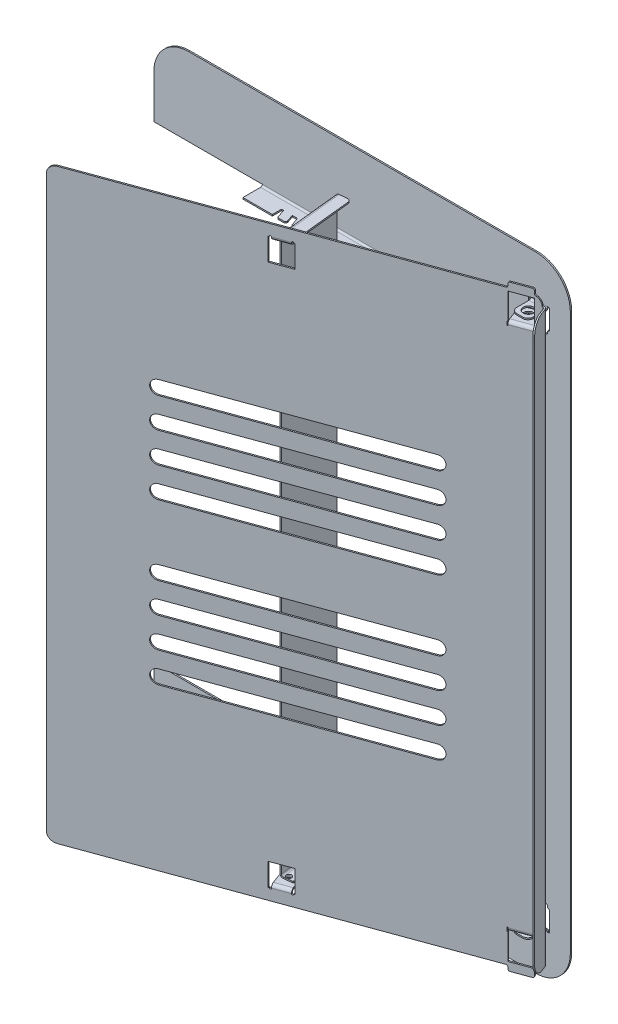
from build123d import *

# Parameters (mm, degrees)
BODY1_DEPTH                    = 0.8
BODY2_DEPTH                    = 115
BODY2_BEND_DEPTH               = 115
CUT_EXTRUDE1_DEPTH             = 10
EDGE_FLANGE5_DEPTH             = 9.5
EDGE_FLANGE5_BEND_DEPTH        = 9.5
FILLET2_R                      = 3
SKETCH25_W                     = 15
SKETCH25_H                     = 12
BODY3_DEPTH                    = 0.8
BODY4_START                    = 95.6
BODY4_DEPTH                    = 12.8
BODY4_2_DEPTH                  = 0.4
BODY4_START_2                  = 108
BODY4_3_DEPTH                  = 0.4
BODY4_START_3                  = 96
BODY4_4_DEPTH                  = 12
FILLET3_R                      = 3
SKETCH34_R                     = 3
CUT_EXTRUDE2_DEPTH             = 454
CUT_EXTRUDE3_DEPTH             = 454
EDGE_FLANGE7_DEPTH             = 9
EDGE_FLANGE7_BEND_DEPTH        = 9
FILLET4_R                      = 3
SKETCH42_W                     = 42
SKETCH42_H                     = 321.4
BASE_FLANGE3_DEPTH             = 0.8
SKETCH45_W                     = 43.953673058
SKETCH45_H                     = 5.967432984
CUT_EXTRUDE4_DEPTH             = 279.8
EDGE_FLANGE8_STRIP_W           = 5.2
EDGE_FLANGE8_STRIP_H           = 0.8
EDGE_FLANGE8_STRIP_CUT_DEPTH   = 42
EDGE_FLANGE8_STRIP_2_W         = 5.2
EDGE_FLANGE8_STRIP_2_H         = 0.8
EDGE_FLANGE8_STRIP_CUT_2_DEPTH = 42
EDGE_FLANGE8_DEPTH             = 42
EDGE_FLANGE8_BEND_DEPTH        = 42
FILLET5_START                  = -160.7
FILLET5_DEPTH                  = 321.4
FILLET6_R                      = 2
SKETCH52_R                     = 1.5
CUT_EXTRUDE5_DEPTH             = 334.8
BODY_MOVE_COPY4_ANGLE          = 20
BODY_MOVE_COPY6_ANGLE          = 77
CUT_EXTRUDE7_DEPTH             = 334.8
BASE_FLANGE4_DEPTH             = 0.8
LPATTERN1_COUNT                = 2
LPATTERN1_PITCH                = 10
LPATTERN2_COUNT                = 3
LPATTERN2_PITCH                = 8
BODY_MOVE_COPY8_ANGLE          = 7
CUT_EXTRUDE8_DEPTH             = 334.8
FILLET7_R                      = 0.5
FILLET8_R                      = 0.5
EDGE_FLANGE9_DEPTH             = 328
FILLET9_R                      = 7
CUT_EXTRUDE9_DEPTH             = 334.8
SKETCH83_W                     = 62.5
SKETCH83_H                     = 270
CUT_EXTRUDE11_DEPTH            = 10


with BuildPart() as part:
    # body1: sheet metal written as solids
    # Sketch1 → body1 (new body)
    with BuildSketch(Plane(origin=(0, 0, 0), x_dir=(0, 1, 0), z_dir=(0, 0, 1))):
        with BuildLine():
            Line((160, -120), (-160, -120))
            ThreePointArc((-160, -120), (-174.142135624, -114.142135624), (-180, -100))
            Line((-180, -100), (-180, 100))
            ThreePointArc((-180, 100), (-174.142135624, 114.142135624), (-160, 120))
            Line((-160, 120), (160, 120))
            ThreePointArc((160, 120), (174.142135624, 114.142135624), (180, 100))
            Line((180, 100), (180, -100))
            ThreePointArc((180, -100), (174.142135624, -114.142135624), (160, -120))
        make_face()
        with BuildLine():
            Line((115, -77.5), (-115, -77.5))
            ThreePointArc((-115, -77.5), (-129.142135624, -71.642135624), (-135, -57.5))
            Line((-135, -57.5), (-135, 57.5))
            ThreePointArc((-135, 57.5), (-129.142135624, 71.642135624), (-115, 77.5))
            Line((-115, 77.5), (115, 77.5))
            ThreePointArc((115, 77.5), (129.142135624, 71.642135624), (135, 57.5))
            Line((135, 57.5), (135, -57.5))
            ThreePointArc((135, -57.5), (129.142135624, -71.642135624), (115, -77.5))
        make_face(mode=Mode.SUBTRACT)
    extrude(amount=-BODY1_DEPTH)

    # body2: sheet metal written as solids
    # body2 section (on a plane across the edge) → body2 (add)
    with BuildSketch(Plane(origin=(57.5, -134, 0), x_dir=(0, -1, 0), z_dir=(-1, 0, 0))):
        with BuildLine():
            Line((-0.8, 1), (-0.8, 11.2))
            Line((-0.8, 11.2), (0, 11.2))
            Line((0, 11.2), (0, 1))
            ThreePointArc((0, 1), (0.292893219, 0.292893219), (1, 0))
            Line((1, 0), (1, -0.8))
            ThreePointArc((1, -0.8), (-0.272792206, -0.272792206), (-0.8, 1))
        make_face()
    extrude(amount=BODY2_DEPTH)

    # body2 section 2 (on a plane across the edge) → body2 bend (add)
    with BuildSketch(Plane(origin=(-57.5, 134, 0), x_dir=(0, 1, 0), z_dir=(1, 0, 0))):
        with BuildLine():
            Line((-0.8, 1), (-0.8, 11.2))
            Line((-0.8, 11.2), (0, 11.2))
            Line((0, 11.2), (0, 1))
            ThreePointArc((0, 1), (0.292893219, 0.292893219), (1, 0))
            Line((1, 0), (1, -0.8))
            ThreePointArc((1, -0.8), (-0.272792206, -0.272792206), (-0.8, 1))
        make_face()
    extrude(amount=BODY2_BEND_DEPTH)

    # Sketch18 → Cut-Extrude1 (cut)
    with BuildSketch(Plane.XY):
        with BuildLine():
            Line((107, 144), (106.85, 144))
            Line((106.85, 144), (106.85, 143))
            ThreePointArc((106.85, 143), (106.557106781, 142.292893219), (105.85, 142))
            Line((105.85, 142), (98.15, 142))
            ThreePointArc((98.15, 142), (97.442893219, 142.292893219), (97.15, 143))
            Line((97.15, 143), (97.15, 144))
            Line((97.15, 144), (97, 144))
            ThreePointArc((97, 144), (96.292893219, 144.292893219), (96, 145))
            Line((96, 145), (96, 156))
            Line((96, 156), (96.75, 156))
            ThreePointArc((96.75, 156), (97, 156.25), (97.25, 156))
            Line((97.25, 156), (106.75, 156))
            ThreePointArc((106.75, 156), (107, 156.25), (107.25, 156))
            Line((107.25, 156), (108, 156))
            Line((108, 156), (108, 145))
            ThreePointArc((108, 145), (107.707106781, 144.292893219), (107, 144))
        make_face()
        with BuildLine():
            Line((108, -156), (107.25, -156))
            ThreePointArc((107.25, -156), (107, -156.25), (106.75, -156))
            Line((106.75, -156), (97.25, -156))
            ThreePointArc((97.25, -156), (97, -156.25), (96.75, -156))
            Line((96.75, -156), (96, -156))
            Line((96, -156), (96, -145))
            ThreePointArc((96, -145), (96.292893219, -144.292893219), (97, -144))
            Line((97, -144), (97.15, -144))
            Line((97.15, -144), (97.15, -143))
            ThreePointArc((97.15, -143), (97.442893219, -142.292893219), (98.15, -142))
            Line((98.15, -142), (105.85, -142))
            ThreePointArc((105.85, -142), (106.557106781, -142.292893219), (106.85, -143))
            Line((106.85, -143), (106.85, -144))
            Line((106.85, -144), (107, -144))
            ThreePointArc((107, -144), (107.707106781, -144.292893219), (108, -145))
            Line((108, -145), (108, -156))
        make_face()
    extrude(amount=-CUT_EXTRUDE1_DEPTH, mode=Mode.SUBTRACT)

    # Edge-Flange5: sheet metal written as solids
    # Edge-Flange5 section (on a plane across the edge) → Edge-Flange5 (add)
    with BuildSketch(Plane(origin=(106.75, -155, 0), x_dir=(0, -1, 0), z_dir=(-1, 0, 0))):
        with BuildLine():
            Line((-0.8, 1), (-0.8, 11.2))
            Line((-0.8, 11.2), (0, 11.2))
            Line((0, 11.2), (0, 1))
            ThreePointArc((0, 1), (0.292893219, 0.292893219), (1, 0))
            Line((1, 0), (1, -0.8))
            ThreePointArc((1, -0.8), (-0.272792206, -0.272792206), (-0.8, 1))
        make_face()
    extrude(amount=EDGE_FLANGE5_DEPTH)

    # Edge-Flange5 section 2 (on a plane across the edge) → Edge-Flange5 bend (add)
    with BuildSketch(Plane(origin=(97.25, 155, 0), x_dir=(0, 1, 0), z_dir=(1, 0, 0))):
        with BuildLine():
            Line((-0.8, 1), (-0.8, 11.2))
            Line((-0.8, 11.2), (0, 11.2))
            Line((0, 11.2), (0, 1))
            ThreePointArc((0, 1), (0.292893219, 0.292893219), (1, 0))
            Line((1, 0), (1, -0.8))
            ThreePointArc((1, -0.8), (-0.272792206, -0.272792206), (-0.8, 1))
        make_face()
    extrude(amount=EDGE_FLANGE5_BEND_DEPTH)

    # Fillet2
    fillet2_edges = [part.edges().sort_by_distance(p)[0] for p in [
        (106.75, -154.6, 11.2),
        (97.25, -154.6, 11.2),
        (97.25, 154.6, 11.2),
        (106.75, 154.6, 11.2),
    ]]
    fillet(fillet2_edges, radius=FILLET2_R)


with BuildPart() as body_2:
    # body3: sheet metal written as solids
    # Sketch25 → body3 (new body)
    with BuildSketch(Plane(origin=(0, 0, 13.2), x_dir=(0, 1, 0), z_dir=(0, 0, 1))):
        with BuildLine():
            Line((164, 111.5), (-164, 111.5))
            ThreePointArc((-164, 111.5), (-167.535533906, 110.035533906), (-169, 106.5))
            Line((-169, 106.5), (-169, -95))
            ThreePointArc((-169, -95), (-169.292893219, -95.707106781), (-170, -96))
            Line((-170, -96), (-171, -96))
            ThreePointArc((-171, -96), (-171.707106781, -96.292893219), (-172, -97))
            Line((-172, -97), (-172, -107))
            ThreePointArc((-172, -107), (-171.707106781, -107.707106781), (-171, -108))
            Line((-171, -108), (-169.454356057, -108))
            ThreePointArc((-169.454356057, -108), (-168.914294332, -108.158374588), (-168.545296714, -108.583333333))
            ThreePointArc((-168.545296714, -108.583333333), (-166.700308624, -110.708127058), (-164, -111.5))
            Line((-164, -111.5), (164, -111.5))
            ThreePointArc((164, -111.5), (166.700308624, -110.708127058), (168.545296714, -108.583333333))
            ThreePointArc((168.545296714, -108.583333333), (168.914294332, -108.158374588), (169.454356057, -108))
            Line((169.454356057, -108), (171, -108))
            ThreePointArc((171, -108), (171.707106781, -107.707106781), (172, -107))
            Line((172, -107), (172, -97))
            ThreePointArc((172, -97), (171.707106781, -96.292893219), (171, -96))
            Line((171, -96), (170, -96))
            ThreePointArc((170, -96), (169.292893219, -95.707106781), (169, -95))
            Line((169, -95), (169, 106.5))
            ThreePointArc((169, 106.5), (167.535533906, 110.035533906), (164, 111.5))
        make_face()
        with Locations((159.8, -102)):
            Rectangle(SKETCH25_W, SKETCH25_H, mode=Mode.SUBTRACT)
        with Locations((-159.8, -102)):
            Rectangle(SKETCH25_W, SKETCH25_H, mode=Mode.SUBTRACT)
    extrude(amount=-BODY3_DEPTH)

    # body4: read off the stored shape, not the designer's step
    # body4 outline → body4 (cut)
    with BuildSketch(Plane.YZ.offset(BODY4_START)):
        with BuildLine():
            ThreePointArc((-151.996662954, 12.4), (-151.348528137, 12.987450787), (-150.5, 13.2))
            Line((-150.5, 13.2), (-152.3, 13.2))
            Line((-152.3, 13.2), (-152.3, 12.4))
            Line((-152.3, 12.4), (-151.996662954, 12.4))
        make_face()
        with BuildLine():
            Line((152.3, 13.2), (150.5, 13.2))
            ThreePointArc((150.5, 13.2), (151.348528137, 12.987450787), (151.996662954, 12.4))
            Line((151.996662954, 12.4), (152.3, 12.4))
            Line((152.3, 12.4), (152.3, 13.2))
        make_face()
    extrude(amount=BODY4_DEPTH, mode=Mode.SUBTRACT)

    # body4 2 outline → body4 2 (cut)
    with BuildSketch(Plane.YZ.offset(BODY4_START)):
        with BuildLine():
            Line((-150.1, 12.4), (-150.1, 13.2))
            Line((-150.1, 13.2), (-150.5, 13.2))
            ThreePointArc((-150.5, 13.2), (-151.348528137, 12.987450787), (-151.996662954, 12.4))
            Line((-151.996662954, 12.4), (-150.1, 12.4))
        make_face()
        with BuildLine():
            Line((150.5, 13.2), (150.1, 13.2))
            Line((150.1, 13.2), (150.1, 12.4))
            Line((150.1, 12.4), (151.996662954, 12.4))
            ThreePointArc((151.996662954, 12.4), (151.348528137, 12.987450787), (150.5, 13.2))
        make_face()
    extrude(amount=BODY4_2_DEPTH, mode=Mode.SUBTRACT)

    # body4 3 outline → body4 3 (cut)
    with BuildSketch(Plane.YZ.offset(BODY4_START_2)):
        with BuildLine():
            Line((-150.1, 12.4), (-150.1, 13.2))
            Line((-150.1, 13.2), (-150.5, 13.2))
            ThreePointArc((-150.5, 13.2), (-151.348528137, 12.987450787), (-151.996662954, 12.4))
            Line((-151.996662954, 12.4), (-150.1, 12.4))
        make_face()
        with BuildLine():
            Line((150.5, 13.2), (150.1, 13.2))
            Line((150.1, 13.2), (150.1, 12.4))
            Line((150.1, 12.4), (151.996662954, 12.4))
            ThreePointArc((151.996662954, 12.4), (151.348528137, 12.987450787), (150.5, 13.2))
        make_face()
    extrude(amount=BODY4_3_DEPTH, mode=Mode.SUBTRACT)

    # body4 4 outline → body4 4 (add)
    with BuildSketch(Plane.YZ.offset(BODY4_START_3)):
        with BuildLine():
            ThreePointArc((-151.5, 11.4), (-151.207106781, 12.107106781), (-150.5, 12.4))
            Line((-150.5, 12.4), (-151.996662954, 12.4))
            ThreePointArc((-151.996662954, 12.4), (-152.222497216, 11.922497216), (-152.3, 11.4))
            Line((-152.3, 11.4), (-152.3, 1.2))
            Line((-152.3, 1.2), (-151.5, 1.2))
            Line((-151.5, 1.2), (-151.5, 11.4))
        make_face()
        with BuildLine():
            Line((151.996662954, 12.4), (150.5, 12.4))
            ThreePointArc((150.5, 12.4), (151.207106781, 12.107106781), (151.5, 11.4))
            Line((151.5, 11.4), (151.5, 1.2))
            Line((151.5, 1.2), (152.3, 1.2))
            Line((152.3, 1.2), (152.3, 11.4))
            ThreePointArc((152.3, 11.4), (152.222497216, 11.922497216), (151.996662954, 12.4))
        make_face()
    extrude(amount=BODY4_4_DEPTH)

    # Fillet3
    fillet3_edges = [body_2.edges().sort_by_distance(p)[0] for p in [
        (108, -151.9, 1.2),
        (96, -151.9, 1.2),
        (96, 151.9, 1.2),
        (108, 151.9, 1.2),
    ]]
    fillet(fillet3_edges, radius=FILLET3_R)


with BuildPart() as cut_extrude2_tool:
    # Sketch34 → Cut-Extrude2 (new body)
    with BuildSketch(Plane.XZ.offset(155)):
        with Locations(Location((102, 6.1, 0), (0, 0, 270))):
            Circle(SKETCH34_R)
    extrude(amount=-CUT_EXTRUDE2_DEPTH)


with BuildPart() as part_1:
    add(part.part)

    # Cut-Extrude2: cut by cut_extrude2_tool
    add(cut_extrude2_tool.part, mode=Mode.SUBTRACT)

    # Sketch45 → Cut-Extrude4 (cut)
    with BuildSketch(Plane(origin=(0, 134, 0), x_dir=(-1, 0, 0), z_dir=(0, 1, 0))):
        with Locations((18.557086861, 8.88567689)):
            Rectangle(SKETCH45_W, SKETCH45_H)
    extrude(amount=-CUT_EXTRUDE4_DEPTH, mode=Mode.SUBTRACT)


with BuildPart() as body_2_1:
    add(body_2.part)

    # Cut-Extrude2: cut by cut_extrude2_tool
    add(cut_extrude2_tool.part, mode=Mode.SUBTRACT)

    # Sketch35 → Cut-Extrude3 (cut)
    with BuildSketch(Plane.XY.offset(13.2)):
        with BuildLine():
            Line((0.25, 149.5), (-11.75, 149.5))
            Line((-11.75, 149.5), (-11.75, 162.5))
            Line((-11.75, 162.5), (-11.25, 162.5))
            ThreePointArc((-11.25, 162.5), (-10.75, 163), (-10.25, 162.5))
            Line((-10.25, 162.5), (-1.25, 162.5))
            ThreePointArc((-1.25, 162.5), (-0.75, 163), (-0.25, 162.5))
            Line((-0.25, 162.5), (0.25, 162.5))
            Line((0.25, 162.5), (0.25, 149.5))
        make_face()
        with BuildLine():
            Line((0.25, -149.5), (-11.75, -149.5))
            Line((-11.75, -149.5), (-11.75, -162.5))
            Line((-11.75, -162.5), (-11.25, -162.5))
            ThreePointArc((-11.25, -162.5), (-10.75, -163), (-10.25, -162.5))
            Line((-10.25, -162.5), (-1.25, -162.5))
            ThreePointArc((-1.25, -162.5), (-0.75, -163), (-0.25, -162.5))
            Line((-0.25, -162.5), (0.25, -162.5))
            Line((0.25, -162.5), (0.25, -149.5))
        make_face()
    extrude(amount=-CUT_EXTRUDE3_DEPTH, mode=Mode.SUBTRACT)

    # Edge-Flange7: sheet metal written as solids
    # Edge-Flange7 section (on a plane across the edge) → Edge-Flange7 (add)
    with BuildSketch(Plane(origin=(-10.25, -161.5, 12.4), x_dir=(0, -1, 0), z_dir=(1, 0, 0))):
        with BuildLine():
            Line((-0.8, 1), (-0.8, 9.2))
            Line((-0.8, 9.2), (0, 9.2))
            Line((0, 9.2), (0, 1))
            ThreePointArc((0, 1), (0.292893219, 0.292893219), (1, 0))
            Line((1, 0), (1, -0.8))
            ThreePointArc((1, -0.8), (-0.272792206, -0.272792206), (-0.8, 1))
        make_face()
    extrude(amount=EDGE_FLANGE7_DEPTH)

    # Edge-Flange7 section 2 (on a plane across the edge) → Edge-Flange7 bend (add)
    with BuildSketch(Plane(origin=(-1.25, 161.5, 12.4), x_dir=(0, 1, 0), z_dir=(-1, 0, 0))):
        with BuildLine():
            Line((-0.8, 1), (-0.8, 9.2))
            Line((-0.8, 9.2), (0, 9.2))
            Line((0, 9.2), (0, 1))
            ThreePointArc((0, 1), (0.292893219, 0.292893219), (1, 0))
            Line((1, 0), (1, -0.8))
            ThreePointArc((1, -0.8), (-0.272792206, -0.272792206), (-0.8, 1))
        make_face()
    extrude(amount=EDGE_FLANGE7_BEND_DEPTH)

    # Fillet4
    fillet4_edges = [body_2_1.edges().sort_by_distance(p)[0] for p in [
        (-10.25, -161.1, 3.2),
        (-1.25, -161.1, 3.2),
        (-1.25, 161.1, 3.2),
        (-10.25, 161.1, 3.2),
    ]]
    fillet(fillet4_edges, radius=FILLET4_R)


with BuildPart() as body_3:
    # Base-Flange3: sheet metal written as solids
    # Sketch42 → Base-Flange3 (new body)
    with BuildSketch(Plane(origin=(0, 0, 12.4), x_dir=(1, 0, 0), z_dir=(0, 0, -1))):
        with Locations((-19.25, 0)):
            Rectangle(SKETCH42_W, SKETCH42_H)
    extrude(amount=BASE_FLANGE3_DEPTH)


with BuildPart() as body_3_1:
    # Body-Move/Copy1: moved
    add(body_3.part.moved(Location((0, 0, -3))))

    # Edge-Flange8: sheet metal written as solids
    # Edge-Flange8 strip (on a plane across the edge) → Edge-Flange8 strip cut (cut)
    with BuildSketch(Plane(origin=(-40.25, 160.7, 8.6), x_dir=(0, -1, 0), z_dir=(1, 0, 0))):
        with Locations((-0.8, -0.4)):
            Rectangle(EDGE_FLANGE8_STRIP_W, EDGE_FLANGE8_STRIP_H)
    extrude(amount=EDGE_FLANGE8_STRIP_CUT_DEPTH, mode=Mode.SUBTRACT)

    # Edge-Flange8 strip 2 (on a plane across the edge) → Edge-Flange8 strip cut 2 (cut)
    with BuildSketch(Plane(origin=(1.75, -160.7, 8.6), x_dir=(0, 1, 0), z_dir=(-1, 0, 0))):
        with Locations((-0.8, -0.4)):
            Rectangle(EDGE_FLANGE8_STRIP_2_W, EDGE_FLANGE8_STRIP_2_H)
    extrude(amount=EDGE_FLANGE8_STRIP_CUT_2_DEPTH, mode=Mode.SUBTRACT)

    # Edge-Flange8 section (on a plane across the edge) → Edge-Flange8 (add)
    with BuildSketch(Plane(origin=(-40.25, 160.7, 8.6), x_dir=(0, -1, 0), z_dir=(1, 0, 0))):
        with BuildLine():
            Line((0, 1), (0, 7.2))
            Line((0, 7.2), (0.8, 7.2))
            Line((0.8, 7.2), (0.8, 1))
            ThreePointArc((0.8, 1), (1.092893219, 0.292893219), (1.8, 0))
            Line((1.8, 0), (1.8, -0.8))
            ThreePointArc((1.8, -0.8), (0.527207794, -0.272792206), (0, 1))
        make_face()
    extrude(amount=EDGE_FLANGE8_DEPTH)

    # Edge-Flange8 section 2 (on a plane across the edge) → Edge-Flange8 bend (add)
    with BuildSketch(Plane(origin=(1.75, -160.7, 8.6), x_dir=(0, 1, 0), z_dir=(-1, 0, 0))):
        with BuildLine():
            Line((0, 1), (0, 7.2))
            Line((0, 7.2), (0.8, 7.2))
            Line((0.8, 7.2), (0.8, 1))
            ThreePointArc((0.8, 1), (1.092893219, 0.292893219), (1.8, 0))
            Line((1.8, 0), (1.8, -0.8))
            ThreePointArc((1.8, -0.8), (0.527207794, -0.272792206), (0, 1))
        make_face()
    extrude(amount=EDGE_FLANGE8_BEND_DEPTH)

    # Fillet5: read off the stored shape, not the designer's step
    # Fillet5 outline → Fillet5 (cut)
    with BuildSketch(Plane(origin=(0, 0, 0), x_dir=(1, 0, 0), z_dir=(0, 1, 0)).offset(FILLET5_START)):
        with BuildLine():
            Line((1.75, -1.4), (-9.329711188, -1.4))
            ThreePointArc((-9.329711188, -1.4), (-2.981483088, -3.055397759), (1.75, -7.6))
            Line((1.75, -7.6), (1.75, -1.4))
        make_face()
    extrude(amount=FILLET5_DEPTH, mode=Mode.SUBTRACT)

    # Fillet6
    fillet6_edges = [body_3_1.edges().sort_by_distance(p)[0] for p in [
        (-40.25, 160.3, 1.4),
        (-40.25, -160.3, 1.4),
    ]]
    fillet(fillet6_edges, radius=FILLET6_R)


with BuildPart() as cut_extrude5_tool:
    # Sketch52 → Cut-Extrude5 (new body)
    with BuildSketch(Plane.XZ.offset(161.5)):
        with Locations(Location((-5.75, 5.949495125, 0), (0, 0, 90))):
            Circle(SKETCH52_R)
    extrude(amount=-CUT_EXTRUDE5_DEPTH)


with BuildPart() as body_3_2:
    add(body_3_1.part)

    # Cut-Extrude5: cut by cut_extrude5_tool
    add(cut_extrude5_tool.part, mode=Mode.SUBTRACT)


with BuildPart() as body_2_2:
    add(body_2_1.part)

    # Cut-Extrude5: cut by cut_extrude5_tool
    add(cut_extrude5_tool.part, mode=Mode.SUBTRACT)


with BuildPart() as body_2_3:
    # Body-Move/Copy4: moved
    add(body_2_2.part.moved(Location((0, 0, 0))).rotate(Axis((102, 0, 6.1), (0, 1, 0)), BODY_MOVE_COPY4_ANGLE))

    # Edge-Flange9: sheet metal written as solids
    # Edge-Flange9 section (on a plane across the edge) → Edge-Flange9 (add)
    with BuildSketch(Plane(origin=(114.295115536, -164, 9.180606103), x_dir=(-0.9396926207858928, 0, 0.3420201433257119), z_dir=(0, 1, 0))):
        with BuildLine():
            Line((-0.8, 1), (-0.8, 11.2))
            Line((-0.8, 11.2), (0, 11.2))
            Line((0, 11.2), (0, 1))
            ThreePointArc((0, 1), (0.292893219, 0.292893219), (1, 0))
            Line((1, 0), (1, -0.8))
            ThreePointArc((1, -0.8), (-0.272792206, -0.272792206), (-0.8, 1))
        make_face()
    extrude(amount=EDGE_FLANGE9_DEPTH)

    # Fillet9
    fillet9_edges = [body_2_3.edges().sort_by_distance(p)[0] for p in [
        (118.501618189, -164, 19.568355398),
        (118.501618189, 164, 19.568355398),
    ]]
    fillet(fillet9_edges, radius=FILLET9_R)

    # Sketch80 → Cut-Extrude9 (cut)
    with BuildSketch(Plane(origin=(16.320578628, 0, 44.840421253), x_dir=(0.9396926207858939, 0, -0.3420201433257087), z_dir=(0.3420201433257087, 0, 0.939692620785894))):
        with BuildLine():
            Line((-69.261750457, 76.197970831), (55.970288205, 76.197970831))
            ThreePointArc((55.970288205, 76.197970831), (59.970288205, 72.197970831), (55.970288205, 68.197970831))
            Line((55.970288205, 68.197970831), (-69.261750457, 68.197970831))
            ThreePointArc((-69.261750457, 68.197970831), (-73.261750457, 72.197970831), (-69.261750457, 76.197970831))
        make_face()
        with BuildLine():
            Line((-69.261750457, 50.849123027), (55.970288205, 50.849123027))
            ThreePointArc((55.970288205, 50.849123027), (59.970288205, 54.849123027), (55.970288205, 58.849123027))
            Line((55.970288205, 58.849123027), (-69.261750457, 58.849123027))
            ThreePointArc((-69.261750457, 58.849123027), (-73.261750457, 54.849123027), (-69.261750457, 50.849123027))
        make_face()
        with BuildLine():
            Line((-69.261750457, 33.500275222), (55.970288205, 33.500275222))
            ThreePointArc((55.970288205, 33.500275222), (59.970288205, 37.500275222), (55.970288205, 41.500275222))
            Line((55.970288205, 41.500275222), (-69.261750457, 41.500275222))
            ThreePointArc((-69.261750457, 41.500275222), (-73.261750457, 37.500275222), (-69.261750457, 33.500275222))
        make_face()
        with BuildLine():
            Line((-69.261750457, 16.151427418), (55.970288205, 16.151427418))
            ThreePointArc((55.970288205, 16.151427418), (59.970288205, 20.151427418), (55.970288205, 24.151427418))
            Line((55.970288205, 24.151427418), (-69.261750457, 24.151427418))
            ThreePointArc((-69.261750457, 24.151427418), (-73.261750457, 20.151427418), (-69.261750457, 16.151427418))
        make_face()
        with BuildLine():
            Line((-69.261750457, -24.151427418), (55.970288205, -24.151427418))
            ThreePointArc((55.970288205, -24.151427418), (59.970288205, -20.151427418), (55.970288205, -16.151427418))
            Line((55.970288205, -16.151427418), (-69.261750457, -16.151427418))
            ThreePointArc((-69.261750457, -16.151427418), (-73.261750457, -20.151427418), (-69.261750457, -24.151427418))
        make_face()
        with BuildLine():
            Line((-69.261750457, -41.500275222), (55.970288205, -41.500275222))
            ThreePointArc((55.970288205, -41.500275222), (59.970288205, -37.500275222), (55.970288205, -33.500275222))
            Line((55.970288205, -33.500275222), (-69.261750457, -33.500275222))
            ThreePointArc((-69.261750457, -33.500275222), (-73.261750457, -37.500275222), (-69.261750457, -41.500275222))
        make_face()
        with BuildLine():
            Line((-69.261750457, -58.849123027), (55.970288205, -58.849123027))
            ThreePointArc((55.970288205, -58.849123027), (59.970288205, -54.849123027), (55.970288205, -50.849123027))
            Line((55.970288205, -50.849123027), (-69.261750457, -50.849123027))
            ThreePointArc((-69.261750457, -50.849123027), (-73.261750457, -54.849123027), (-69.261750457, -58.849123027))
        make_face()
        with BuildLine():
            Line((-69.261750457, -76.197970831), (55.970288205, -76.197970831))
            ThreePointArc((55.970288205, -76.197970831), (59.970288205, -72.197970831), (55.970288205, -68.197970831))
            Line((55.970288205, -68.197970831), (-69.261750457, -68.197970831))
            ThreePointArc((-69.261750457, -68.197970831), (-73.261750457, -72.197970831), (-69.261750457, -76.197970831))
        make_face()
    extrude(amount=-CUT_EXTRUDE9_DEPTH, mode=Mode.SUBTRACT)


with BuildPart() as body_3_3:
    # Body-Move/Copy5: read off the stored shape, not the designer's step
    # Body-Move/Copy5: moved
    add(body_3_2.part.moved(Location((6.4466444, 0, 36.861747))))


with BuildPart() as body_3_4:
    # Body-Move/Copy6: moved
    add(body_3_3.part.moved(Location((0, 0, 0))).rotate(Axis((0.696644411, 0, 42.811242123), (0, -1, 0)), BODY_MOVE_COPY6_ANGLE))

    # Sketch56 → Cut-Extrude7 (cut)
    with BuildSketch(Plane(origin=(0, 160.7, 0), x_dir=(-1, 0, 0), z_dir=(0, 1, 0))):
        Polygon((-6.198410509, 43.300520378), (5.452037396, 45.990238212), (3.574063445, 54.124637073), (-8.07638446, 51.43491924), align=None)
    extrude(amount=-CUT_EXTRUDE7_DEPTH, mode=Mode.SUBTRACT)


with BuildPart() as body_4:
    # Base-Flange4: sheet metal written as solids
    # Sketch57 → Base-Flange4 (new body)
    with BuildSketch(Plane.XZ.offset(134)):
        with BuildLine():
            Line((-23.340517945, 5.901960398), (-21.743947941, 10.526347575))
            ThreePointArc((-21.743947941, 10.526347575), (-21.379065409, 11.014354829), (-20.798698101, 11.2))
            Line((-20.798698101, 11.2), (-17.914540828, 11.2))
            ThreePointArc((-17.914540828, 11.2), (-17.100185999, 10.780367308), (-16.969290988, 9.873652425))
            Line((-16.969290988, 9.873652425), (-18.340517945, 5.901960398))
            Line((-18.340517945, 5.901960398), (-23.340517945, 5.901960398))
        make_face()
    extrude(amount=-BASE_FLANGE4_DEPTH)


with BuildPart() as lpattern1_1:
    # LPattern1: pattern copy
    add(body_4.part.moved(Location(Vector(1, 0, 0) * (1 * LPATTERN1_PITCH))))


with BuildPart() as lpattern2_1:
    # LPattern2: pattern copy
    add(body_4.part.moved(Location(Vector(-1, 0, 0) * (1 * LPATTERN2_PITCH))))


with BuildPart() as lpattern2_2:
    # LPattern2: pattern copy
    add(body_4.part.moved(Location(Vector(-1, 0, 0) * (2 * LPATTERN2_PITCH))))


with BuildPart() as body_8:
    # Mirror1: mirrored copy
    add(lpattern2_2.part.mirror(Plane.ZX))


with BuildPart() as body_9:
    # Mirror1 2: mirrored copy
    add(lpattern2_1.part.mirror(Plane.ZX))


with BuildPart() as body_10:
    # Mirror1 3: mirrored copy
    add(body_4.part.mirror(Plane.ZX))


with BuildPart() as body_11:
    # Mirror1 4: mirrored copy
    add(lpattern1_1.part.mirror(Plane.ZX))


with BuildPart() as part_2:
    add(part_1.part)

    # Combine1: union LPattern2_2, LPattern2_1, body 4, LPattern1_1, body 11, body 10, body 9, body 8
    add(lpattern2_2.part)
    add(lpattern2_1.part)
    add(body_4.part)
    add(lpattern1_1.part)
    add(body_11.part)
    add(body_10.part)
    add(body_9.part)
    add(body_8.part)

    # Sketch76 → Cut-Extrude8 (cut)
    with BuildSketch(Plane(origin=(0, 134, 0), x_dir=(-1, 0, 0), z_dir=(0, 1, 0))):
        Polygon((-16.625698455, 11.2), (-19.563416468, 5.901960398), (-25.05231065, 5.901960398), (-22.114592637, 11.2), align=None)
        Polygon((-26.625698455, 11.2), (-29.563416468, 5.901960398), (-35.05231065, 5.901960398), (-32.114592637, 11.2), align=None)
    extrude(amount=-CUT_EXTRUDE8_DEPTH, mode=Mode.SUBTRACT)

    # Fillet7
    fillet7_edges = [part_2.edges().sort_by_distance(p)[0] for p in [
        (22.114592637, 133.6, 11.2),
    ]]
    fillet(fillet7_edges, radius=FILLET7_R)

    # Fillet8
    fillet8_edges = [part_2.edges().sort_by_distance(p)[0] for p in [
        (22.114592637, -133.6, 11.2),
        (16.625698455, -133.6, 11.2),
        (16.625698455, 133.6, 11.2),
        (32.114592637, -133.6, 11.2),
        (32.114592637, 133.6, 11.2),
        (26.625698455, -133.6, 11.2),
        (26.625698455, 133.6, 11.2),
    ]]
    fillet(fillet8_edges, radius=FILLET8_R)

    # Sketch83 → Cut-Extrude11 (cut)
    with BuildSketch(Plane(origin=(0, 0, -0.8), x_dir=(1, 0, 0), z_dir=(0, 0, -1))):
        with Locations((-88.75, 0)):
            Rectangle(SKETCH83_W, SKETCH83_H)
    extrude(amount=-CUT_EXTRUDE11_DEPTH, mode=Mode.SUBTRACT)


with BuildPart() as body_3_5:
    # Body-Move/Copy8: moved
    add(body_3_4.part.moved(Location((0, 0, 0))).rotate(Axis((0.696644411, 0, 42.811242123), (0, -1, 0)), BODY_MOVE_COPY8_ANGLE))


solid = Compound([body_2_3.part, part_2.part, body_3_5.part])
